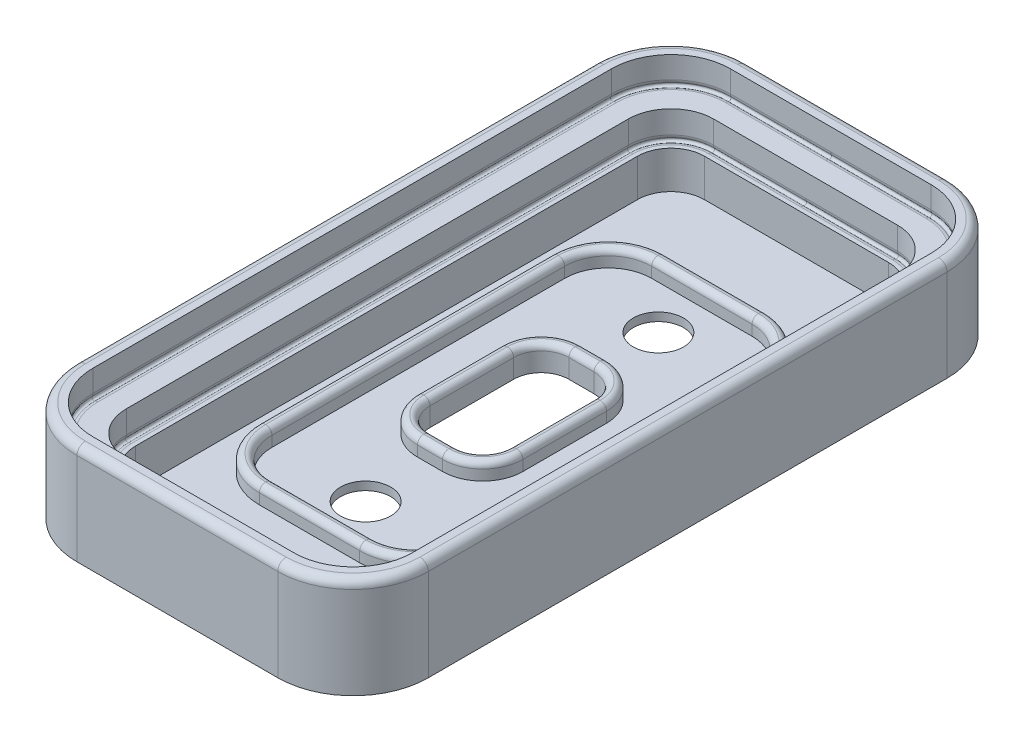
from build123d import *

# Parameters (mm, degrees)
BOSS_EXTRUDE1_DEPTH = 8.8
CUT_EXTRUDE3_DEPTH  = 46.510987684
CUT_EXTRUDE4_DEPTH  = 46.8458286
BOSS_EXTRUDE2_DEPTH = 2
CUT_EXTRUDE5_START  = -2
SKETCH8_3_R         = 3
CUT_EXTRUDE5_DEPTH  = 2
FILLET1_R           = 0.75
BOSS_EXTRUDE3_DEPTH = 3.2
FILLET3_R           = 1
CUT_EXTRUDE7_DEPTH  = 46.642633579
CUT_EXTRUDE8_DEPTH  = 47.026514098
SKETCH13_R          = 0.25
SKETCH15_R          = 0.25
FILLET4_R           = 0.75


with BuildPart() as part:
    # Sketch1 → Boss-Extrude1 (new body)
    with BuildSketch(Plane(origin=(0, 0, 0), x_dir=(1, 0, 0), z_dir=(0, 1, 0))):
        with BuildLine():
            Line((-12, -40), (12, -40))
            ThreePointArc((12, -40), (18.363961031, -37.363961031), (21, -31))
            Line((21, -31), (21, 31))
            ThreePointArc((21, 31), (18.363961031, 37.363961031), (12, 40))
            Line((12, 40), (-12, 40))
            ThreePointArc((-12, 40), (-18.363961031, 37.363961031), (-21, 31))
            Line((-21, 31), (-21, -31))
            ThreePointArc((-21, -31), (-18.363961031, -37.363961031), (-12, -40))
        make_face()
    extrude(amount=BOSS_EXTRUDE1_DEPTH)

    # Sketch4 → Cut-Extrude3 (cut, through all)
    with BuildSketch(Plane(origin=(0, 5.5, 0), x_dir=(-1, 0, 0), z_dir=(0, -1, 0))):
        with BuildLine():
            Line((-16, -30), (-16, 30))
            ThreePointArc((-16, 30), (-14.535533906, 33.535533906), (-11, 35))
            Line((-11, 35), (11, 35))
            ThreePointArc((11, 35), (14.535533906, 33.535533906), (16, 30))
            Line((16, 30), (16, -30))
            ThreePointArc((16, -30), (14.535533906, -33.535533906), (11, -35))
            Line((11, -35), (-11, -35))
            ThreePointArc((-11, -35), (-14.535533906, -33.535533906), (-16, -30))
        make_face()
    extrude(amount=-CUT_EXTRUDE3_DEPTH, mode=Mode.SUBTRACT)

    # Sketch6 → Cut-Extrude4 (cut, through all)
    with BuildSketch(Plane(origin=(0, 1, 0), x_dir=(1, 0, 0), z_dir=(0, 1, 0))):
        with BuildLine():
            Line((-11, -34), (11, -34))
            ThreePointArc((11, -34), (13.828427125, -32.828427125), (15, -30))
            Line((15, -30), (15, 30))
            ThreePointArc((15, 30), (13.828427125, 32.828427125), (11, 34))
            Line((11, 34), (-11, 34))
            ThreePointArc((-11, 34), (-13.828427125, 32.828427125), (-15, 30))
            Line((-15, 30), (-15, -30))
            ThreePointArc((-15, -30), (-13.828427125, -32.828427125), (-11, -34))
        make_face()
    extrude(amount=CUT_EXTRUDE4_DEPTH, mode=Mode.SUBTRACT)

    # Sketch8 → Boss-Extrude2 (add)
    # profile 1 of 2: a face of its own
    with BuildSketch(Plane(origin=(0, 1, 0), x_dir=(1, 0, 0), z_dir=(0, 1, 0))):
        with BuildLine():
            Line((6, 24.2), (-6, 24.2))
            ThreePointArc((-6, 24.2), (-10.737615434, 22.237615434), (-12.7, 17.5))
            Line((-12.7, 17.5), (-12.7, -17.5))
            ThreePointArc((-12.7, -17.5), (-10.737615434, -22.237615434), (-6, -24.2))
            Line((-6, -24.2), (6, -24.2))
            ThreePointArc((6, -24.2), (10.737615434, -22.237615434), (12.7, -17.5))
            Line((12.7, -17.5), (12.7, 17.5))
            ThreePointArc((12.7, 17.5), (10.737615434, 22.237615434), (6, 24.2))
        make_face()
        with BuildLine():
            ThreePointArc((-6, 22.7), (-9.676955262, 21.176955262), (-11.2, 17.5))
            Line((-11.2, 17.5), (-11.2, -17.5))
            ThreePointArc((-11.2, -17.5), (-9.676955262, -21.176955262), (-6, -22.7))
            Line((-6, -22.7), (6, -22.7))
            ThreePointArc((6, -22.7), (9.676955262, -21.176955262), (11.2, -17.5))
            Line((11.2, -17.5), (11.2, 17.5))
            ThreePointArc((11.2, 17.5), (9.676955262, 21.176955262), (6, 22.7))
            Line((6, 22.7), (-6, 22.7))
        make_face(mode=Mode.SUBTRACT)
    # profile 2 of 2: a face of its own
    with BuildSketch(Plane(origin=(0, 1, 0), x_dir=(1, 0, 0), z_dir=(0, 1, 0))):
        with BuildLine():
            Line((1.5, 9.8), (-1.5, 9.8))
            ThreePointArc((-1.5, 9.8), (-4.89411255, 8.39411255), (-6.3, 5))
            Line((-6.3, 5), (-6.3, -5))
            ThreePointArc((-6.3, -5), (-4.89411255, -8.39411255), (-1.5, -9.8))
            Line((-1.5, -9.8), (1.5, -9.8))
            ThreePointArc((1.5, -9.8), (4.89411255, -8.39411255), (6.3, -5))
            Line((6.3, -5), (6.3, 5))
            ThreePointArc((6.3, 5), (4.89411255, 8.39411255), (1.5, 9.8))
        make_face()
        with BuildLine():
            ThreePointArc((1.5, -8.3), (3.833452378, -7.333452378), (4.8, -5))
            Line((4.8, -5), (4.8, 5))
            ThreePointArc((4.8, 5), (3.833452378, 7.333452378), (1.5, 8.3))
            Line((1.5, 8.3), (-1.5, 8.3))
            ThreePointArc((-1.5, 8.3), (-3.833452378, 7.333452378), (-4.8, 5))
            Line((-4.8, 5), (-4.8, -5))
            ThreePointArc((-4.8, -5), (-3.833452378, -7.333452378), (-1.5, -8.3))
            Line((-1.5, -8.3), (1.5, -8.3))
        make_face(mode=Mode.SUBTRACT)
    extrude(amount=BOSS_EXTRUDE2_DEPTH)

    # Sketch8<3> → Cut-Extrude5 (cut)
    with BuildSketch(Plane(origin=(0, 1, 0), x_dir=(1, 0, 0), z_dir=(0, 1, 0)).offset(CUT_EXTRUDE5_START)):
        with BuildLine():
            Line((-1.5, -8.3), (1.5, -8.3))
            ThreePointArc((1.5, -8.3), (3.833452378, -7.333452378), (4.8, -5))
            Line((4.8, -5), (4.8, 5))
            ThreePointArc((4.8, 5), (3.833452378, 7.333452378), (1.5, 8.3))
            Line((1.5, 8.3), (-1.5, 8.3))
            ThreePointArc((-1.5, 8.3), (-3.833452378, 7.333452378), (-4.8, 5))
            Line((-4.8, 5), (-4.8, -5))
            ThreePointArc((-4.8, -5), (-3.833452378, -7.333452378), (-1.5, -8.3))
        make_face()
        with Locations(Location((0, 17.5, 0), (0, 0, 270))):
            Circle(SKETCH8_3_R)
        with Locations(Location((0, -17.5, 0), (0, 0, 270))):
            Circle(SKETCH8_3_R)
    extrude(amount=CUT_EXTRUDE5_DEPTH, mode=Mode.SUBTRACT)

    # Fillet1
    fillet1_edges = [part.edges().sort_by_distance(p)[0] for p in [
        (-10.737615434, 3, -22.237615434),
        (-12.7, 3, 0),
        (-10.737615434, 3, 22.237615434),
        (0, 3, 24.2),
        (10.737615434, 3, 22.237615434),
        (12.7, 3, 0),
        (10.737615434, 3, -22.237615434),
        (3.833452378, 3, 7.333452378),
        (0, 3, 8.3),
        (-3.833452378, 3, 7.333452378),
        (-4.8, 3, 0),
        (-3.833452378, 3, -7.333452378),
        (0, 3, -8.3),
        (3.833452378, 3, -7.333452378),
        (4.8, 3, 0),
        (0, 3, -9.8),
        (-4.89411255, 3, -8.39411255),
        (-6.3, 3, 0),
        (-4.89411255, 3, 8.39411255),
        (0, 3, 9.8),
        (4.89411255, 3, 8.39411255),
        (6.3, 3, 0),
        (4.89411255, 3, -8.39411255),
        (-9.676955262, 3, -21.176955262),
        (0, 3, -22.7),
        (9.676955262, 3, -21.176955262),
        (11.2, 3, 0),
        (9.676955262, 3, 21.176955262),
        (0, 3, 22.7),
        (-9.676955262, 3, 21.176955262),
        (-11.2, 3, 0),
        (0, 3, -24.2),
    ]]
    fillet(fillet1_edges, radius=FILLET1_R - 0.0001)  # a hair under: the kernel refuses the full size

    # Sketch9 → Boss-Extrude3 (add)
    with BuildSketch(Plane(origin=(0, 8.8, 0), x_dir=(1, 0, 0), z_dir=(0, 1, 0))):
        with BuildLine():
            Line((-12, -40), (12, -40))
            ThreePointArc((12, -40), (18.363961031, -37.363961031), (21, -31))
            Line((21, -31), (21, 31))
            ThreePointArc((21, 31), (18.363961031, 37.363961031), (12, 40))
            Line((12, 40), (-12, 40))
            ThreePointArc((-12, 40), (-18.363961031, 37.363961031), (-21, 31))
            Line((-21, 31), (-21, -31))
            ThreePointArc((-21, -31), (-18.363961031, -37.363961031), (-12, -40))
        make_face()
        with BuildLine():
            Line((-12, -38), (12, -38))
            ThreePointArc((12, -38), (16.949747468, -35.949747468), (19, -31))
            Line((19, -31), (19, 31))
            ThreePointArc((19, 31), (16.949747468, 35.949747468), (12, 38))
            Line((12, 38), (-12, 38))
            ThreePointArc((-12, 38), (-16.949747468, 35.949747468), (-19, 31))
            Line((-19, 31), (-19, -31))
            ThreePointArc((-19, -31), (-16.949747468, -35.949747468), (-12, -38))
        make_face(mode=Mode.SUBTRACT)
    extrude(amount=BOSS_EXTRUDE3_DEPTH)

    # Fillet3
    fillet3_edges = [part.edges().sort_by_distance(p)[0] for p in [
        (-18.363961031, 12, 37.363961031),
        (0, 12, 40),
        (18.363961031, 12, 37.363961031),
        (21, 12, 0),
        (18.363961031, 12, -37.363961031),
        (0, 12, -40),
        (-18.363961031, 12, -37.363961031),
        (-21, 12, 0),
    ]]
    fillet(fillet3_edges, radius=FILLET3_R)

    # Sketch11 → Cut-Extrude7 (cut, through all)
    with BuildSketch(Plane(origin=(0, 5.5, 0), x_dir=(1, 0, 0), z_dir=(0, 1, 0))):
        with BuildLine():
            Line((16.1, -30), (16.1, 30))
            ThreePointArc((16.1, 30), (14.606244584, 33.606244584), (11, 35.1))
            Line((11, 35.1), (-11, 35.1))
            ThreePointArc((-11, 35.1), (-14.606244584, 33.606244584), (-16.1, 30))
            Line((-16.1, 30), (-16.1, -30))
            ThreePointArc((-16.1, -30), (-14.606244584, -33.606244584), (-11, -35.1))
            Line((-11, -35.1), (11, -35.1))
            ThreePointArc((11, -35.1), (14.606244584, -33.606244584), (16.1, -30))
        make_face()
        with BuildLine():
            Line((16, -30), (16, 30))
            ThreePointArc((16, 30), (14.535533906, 33.535533906), (11, 35))
            Line((11, 35), (-11, 35))
            ThreePointArc((-11, 35), (-14.535533906, 33.535533906), (-16, 30))
            Line((-16, 30), (-16, -30))
            ThreePointArc((-16, -30), (-14.535533906, -33.535533906), (-11, -35))
            Line((-11, -35), (11, -35))
            ThreePointArc((11, -35), (14.535533906, -33.535533906), (16, -30))
        make_face(mode=Mode.SUBTRACT)
    extrude(amount=CUT_EXTRUDE7_DEPTH, mode=Mode.SUBTRACT)

    # Sketch12 → Cut-Extrude8 (cut, through all)
    with BuildSketch(Plane(origin=(0, 8.8, 0), x_dir=(1, 0, 0), z_dir=(0, 1, 0))):
        with BuildLine():
            Line((-19.1, 31), (-19.1, -31))
            ThreePointArc((-19.1, -31), (-17.020458146, -36.020458146), (-12, -38.1))
            Line((-12, -38.1), (12, -38.1))
            ThreePointArc((12, -38.1), (17.020458146, -36.020458146), (19.1, -31))
            Line((19.1, -31), (19.1, 31))
            ThreePointArc((19.1, 31), (17.020458146, 36.020458146), (12, 38.1))
            Line((12, 38.1), (-12, 38.1))
            ThreePointArc((-12, 38.1), (-17.020458146, 36.020458146), (-19.1, 31))
        make_face()
        with BuildLine():
            Line((-19, 31), (-19, -31))
            ThreePointArc((-19, -31), (-16.949747468, -35.949747468), (-12, -38))
            Line((-12, -38), (12, -38))
            ThreePointArc((12, -38), (16.949747468, -35.949747468), (19, -31))
            Line((19, -31), (19, 31))
            ThreePointArc((19, 31), (16.949747468, 35.949747468), (12, 38))
            Line((12, 38), (-12, 38))
            ThreePointArc((-12, 38), (-16.949747468, 35.949747468), (-19, 31))
        make_face(mode=Mode.SUBTRACT)
    extrude(amount=CUT_EXTRUDE8_DEPTH, mode=Mode.SUBTRACT)

    # Cut-Sweep1: sweep along a path in Sketch14
    with BuildLine(Plane(origin=(0, 8.8, 0), x_dir=(1, 0, 0), z_dir=(0, 1, 0))) as cut_sweep1_path:
        Line((-19.1, 31), (-19.1, -31))
        ThreePointArc((-19.1, -31), (-17.020458146, -36.020458146), (-12, -38.1))
        Line((-12, -38.1), (12, -38.1))
        ThreePointArc((12, -38.1), (17.020458146, -36.020458146), (19.1, -31))
        Line((19.1, -31), (19.1, 31))
        ThreePointArc((19.1, 31), (17.020458146, 36.020458146), (12, 38.1))
        Line((12, 38.1), (-12, 38.1))
        ThreePointArc((-12, 38.1), (-17.020458146, 36.020458146), (-19.1, 31))
    # Sketch13 → Cut-Sweep1 (sweep, cut)
    with BuildSketch(Plane(origin=(0, 0, 0), x_dir=(0, 0, -1), z_dir=(1, 0, 0))):
        with Locations((37.958578644, 8.941421356)):
            Circle(SKETCH13_R)
    sweep(path=cut_sweep1_path.line, mode=Mode.SUBTRACT)

    # Cut-Sweep2: sweep along a path in Sketch16
    with BuildLine(Plane(origin=(0, 5.5, 0), x_dir=(1, 0, 0), z_dir=(0, 1, 0))) as cut_sweep2_path:
        Line((16.1, -30), (16.1, 30))
        ThreePointArc((16.1, 30), (14.606244584, 33.606244584), (11, 35.1))
        Line((11, 35.1), (-11, 35.1))
        ThreePointArc((-11, 35.1), (-14.606244584, 33.606244584), (-16.1, 30))
        Line((-16.1, 30), (-16.1, -30))
        ThreePointArc((-16.1, -30), (-14.606244584, -33.606244584), (-11, -35.1))
        Line((-11, -35.1), (11, -35.1))
        ThreePointArc((11, -35.1), (14.606244584, -33.606244584), (16.1, -30))
    # Sketch15 → Cut-Sweep2 (sweep, cut)
    with BuildSketch(Plane(origin=(0, 0, 0), x_dir=(0, 0, -1), z_dir=(1, 0, 0))):
        with Locations((34.958578644, 5.641421356)):
            Circle(SKETCH15_R)
    sweep(path=cut_sweep2_path.line, mode=Mode.SUBTRACT)

    # Fillet4
    fillet4_edges = [part.edges().sort_by_distance(p)[0] for p in [
        (0, 9.147576638, -38.1),
        (0, 9.147576638, -38.1),
        (19.1, 9.147576638, 0),
        (0, 9.147576638, 38.1),
        (-19.1, 9.147576638, 0),
        (-17.020458146, 9.147576638, 36.020458146),
        (17.020458146, 9.147576638, 36.020458146),
        (-17.020458146, 9.147576638, -36.020458146),
        (17.020458146, 9.147576638, -36.020458146),
        (0, 8.8, -37.752423362),
        (-16.774684349, 8.8, -35.774684349),
        (-18.752423362, 8.8, 0),
        (-16.774684349, 8.8, 35.774684349),
        (0, 8.8, 37.752423362),
        (16.774684349, 8.8, 35.774684349),
        (18.752423362, 8.8, 0),
        (16.774684349, 8.8, -35.774684349),
        (0, 8.8, -37.752423362),
        (0, 5.847576638, 35.1),
        (-16.1, 5.847576638, 0),
        (0, 5.847576638, -35.1),
        (0, 5.847576638, -35.1),
        (16.1, 5.847576638, 0),
        (15.752423362, 5.5, 0),
        (0, 5.5, -34.752423362),
        (14.360470787, 5.5, -33.360470787),
        (14.606244584, 5.847576638, -33.606244584),
        (0, 5.5, -34.752423362),
        (-14.360470787, 5.5, -33.360470787),
        (-14.606244584, 5.847576638, -33.606244584),
        (-15.752423362, 5.5, 0),
        (-14.360470787, 5.5, 33.360470787),
        (-14.606244584, 5.847576638, 33.606244584),
        (0, 5.5, 34.752423362),
        (14.360470787, 5.5, 33.360470787),
        (14.606244584, 5.847576638, 33.606244584),
    ]]
    fillet(fillet4_edges, radius=FILLET4_R)


solid = part.part
